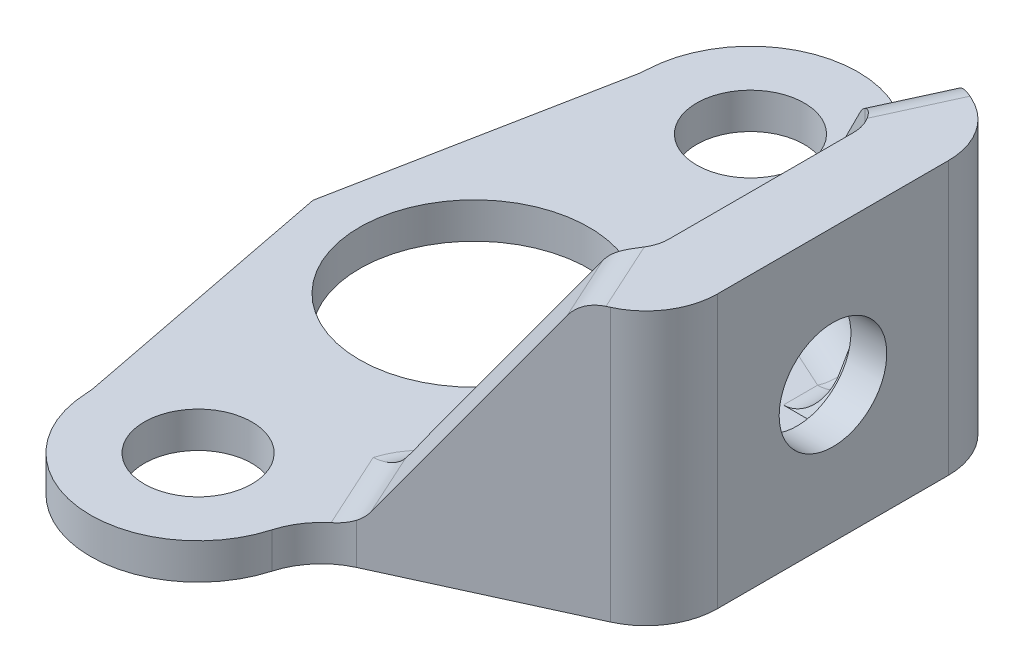
from build123d import *

# Parameters (mm, degrees)
ESQUISSE1_R                  = 3.2
ESQUISSE1_R_2                = 1.5
BOSS_EXTRU_1_DEPTH           = 1
BOSS_EXTRU_2_START           = 6.6
BOSS_EXTRU_2_DEPTH           = 6.6
CHANFREIN1_SIZE              = 6.6
CHANFREIN1_SIZE_2            = 4.73
CONG_1_R                     = 1
ENL_V_MAT_EXTRU_1_DEPTH      = 18.728508153
ENL_V_MAT_EXTRU_1_DEPTH_BACK = 1
ENL_V_MAT_EXTRU_2_DEPTH      = 18.728508153
ENL_V_MAT_EXTRU_2_DEPTH_BACK = 18.728508153
ESQUISSE2_3_R                = 1.5


with BuildPart() as part:
    # Esquisse1 → Boss.-Extru.1 (new body)
    # profile 1 of 2: a face of its own
    with BuildSketch(Plane(origin=(0, 0, 0), x_dir=(1, 0, 0), z_dir=(0, 1, 0))):
        with BuildLine():
            Line((7.41575976, 3.482294806), (4.054342249, 5.018942811))
            ThreePointArc((4.054342249, 5.018942811), (3.533019895, 5.579308264), (3.560627534, 6.344177047))
            Line((3.560627534, 6.344177047), (3.976387294, 7.253651523))
            ThreePointArc((3.976387294, 7.253651523), (3.291254041, 7.768850358), (2.884744089, 8.523560284))
            ThreePointArc((2.884744089, 8.523560284), (-0.351141019, 10.679379127), (-2.997167453, 7.830335178))
            ThreePointArc((-2.997167453, 7.830335178), (-3.009169797, 7.681917242), (-3.032181114, 7.534803614))
            Line((-3.032181114, 7.534803614), (-4.5, 0))
            Line((-4.5, 0), (-3.032181114, -7.534803614))
            ThreePointArc((-3.032181114, -7.534803614), (-3.009169797, -7.681917242), (-2.997167453, -7.830335178))
            ThreePointArc((-2.997167453, -7.830335178), (-0.351141019, -10.679379127), (2.884744089, -8.523560284))
            ThreePointArc((2.884744089, -8.523560284), (3.291254041, -7.768850358), (3.976387294, -7.253651523))
            Line((3.976387294, -7.253651523), (3.560627534, -6.344177047))
            ThreePointArc((3.560627534, -6.344177047), (3.533019895, -5.579308264), (4.054342249, -5.018942811))
            Line((4.054342249, -5.018942811), (7.41575976, -3.482294806))
            ThreePointArc((7.41575976, -3.482294806), (7.841355977, -3.113301708), (8, -2.572820331))
            Line((8, -2.572820331), (8, 2.572820331))
            ThreePointArc((8, 2.572820331), (7.841355977, 3.113301708), (7.41575976, 3.482294806))
        make_face()
        with Locations(Location((0, 0, 0), (0, 0, 270))):
            Circle(ESQUISSE1_R, mode=Mode.SUBTRACT)
        with Locations(Location((0, 7.7, 0), (0, 0, 270))):
            Circle(ESQUISSE1_R_2, mode=Mode.SUBTRACT)
        with Locations(Location((0, -7.7, 0), (0, 0, 270))):
            Circle(ESQUISSE1_R_2, mode=Mode.SUBTRACT)
    # profile 2 of 2: a face of its own
    with BuildSketch(Plane(origin=(0, 0, 0), x_dir=(1, 0, 0), z_dir=(0, 1, 0))):
        with BuildLine():
            ThreePointArc((4.054342249, 5.018942811), (3.533019895, 5.579308264), (3.560627534, 6.344177047))
            Line((3.560627534, 6.344177047), (3.976387294, 7.253651523))
            Line((3.976387294, 7.253651523), (8.831519521, 5.034162505))
            ThreePointArc((8.831519521, 5.034162505), (9.682711954, 4.29617631), (10, 3.215213554))
            Line((10, 3.215213554), (10, -3.215213554))
            ThreePointArc((10, -3.215213554), (9.682711954, -4.29617631), (8.831519521, -5.034162505))
            Line((8.831519521, -5.034162505), (3.976387294, -7.253651523))
            Line((3.976387294, -7.253651523), (3.560627534, -6.344177047))
            ThreePointArc((3.560627534, -6.344177047), (3.533019895, -5.579308264), (4.054342249, -5.018942811))
            Line((4.054342249, -5.018942811), (7.41575976, -3.482294806))
            ThreePointArc((7.41575976, -3.482294806), (7.841355977, -3.113301708), (8, -2.572820331))
            Line((8, -2.572820331), (8, 2.572820331))
            ThreePointArc((8, 2.572820331), (7.841355977, 3.113301708), (7.41575976, 3.482294806))
            Line((7.41575976, 3.482294806), (4.054342249, 5.018942811))
        make_face()
    extrude(amount=-BOSS_EXTRU_1_DEPTH)

    # Esquisse1<3> → Boss.-Extru.2 (add)
    with BuildSketch(Plane(origin=(0, 0, 0), x_dir=(1, 0, 0), z_dir=(0, 1, 0)).offset(BOSS_EXTRU_2_START)):
        with BuildLine():
            ThreePointArc((4.054342249, 5.018942811), (3.533019895, 5.579308264), (3.560627534, 6.344177047))
            Line((3.560627534, 6.344177047), (3.976387294, 7.253651523))
            Line((3.976387294, 7.253651523), (8.831519521, 5.034162505))
            ThreePointArc((8.831519521, 5.034162505), (9.682711954, 4.29617631), (10, 3.215213554))
            Line((10, 3.215213554), (10, -3.215213554))
            ThreePointArc((10, -3.215213554), (9.682711954, -4.29617631), (8.831519521, -5.034162505))
            Line((8.831519521, -5.034162505), (3.976387294, -7.253651523))
            Line((3.976387294, -7.253651523), (3.560627534, -6.344177047))
            ThreePointArc((3.560627534, -6.344177047), (3.533019895, -5.579308264), (4.054342249, -5.018942811))
            Line((4.054342249, -5.018942811), (7.41575976, -3.482294806))
            ThreePointArc((7.41575976, -3.482294806), (7.841355977, -3.113301708), (8, -2.572820331))
            Line((8, -2.572820331), (8, 2.572820331))
            ThreePointArc((8, 2.572820331), (7.841355977, 3.113301708), (7.41575976, 3.482294806))
            Line((7.41575976, 3.482294806), (4.054342249, 5.018942811))
        make_face()
    extrude(amount=-BOSS_EXTRU_2_DEPTH)

    # Chanfrein1
    # the kernel refuses this chamfer: 6.6, 4.73 mm, written as the material it takes off along each edge
    with BuildSketch(Plane(origin=(11.061264904, 6.6, 22.751821295), x_dir=(-0.020518924966706303, -0.9997454615139245, 0.009380079984775464), z_dir=(-0.4157597602676271, 0, -0.9094744755858766))) as chanfrein1_piece_1_section:
        Polygon((CHANFREIN1_SIZE * 0.999745461514, -CHANFREIN1_SIZE * 0.0225612983294), (-CHANFREIN1_SIZE_2 * 0.0225612983294, -CHANFREIN1_SIZE_2 * 0.999745461514), (0, 0), align=None)
    chanfrein1_piece_1 = extrude(amount=35.081593686, mode=Mode.PRIVATE)
    chanfrein1_piece_1 = split(chanfrein1_piece_1, bisect_by=Plane(origin=(5.170241743, 0, 6.158121449), z_dir=(0, 1, 0)), keep=Keep.TOP, mode=Mode.PRIVATE)
    add(chanfrein1_piece_1, mode=Mode.SUBTRACT)
    with BuildSketch(Plane(origin=(-3.524250076, 6.6, 9.153992725), x_dir=(-0.0205189249667065, -0.9997454615139245, -0.009380079984775552), z_dir=(0.4157597602676271, 0, -0.9094744755858766))) as chanfrein1_piece_2_section:
        Polygon((CHANFREIN1_SIZE * 0.999745461514, -CHANFREIN1_SIZE * 0.0225612983294), (-CHANFREIN1_SIZE_2 * 0.0225612983294, -CHANFREIN1_SIZE_2 * 0.999745461514), (0, 0), align=None)
    chanfrein1_piece_2 = extrude(amount=35.081593686, mode=Mode.PRIVATE)
    chanfrein1_piece_2 = split(chanfrein1_piece_2, bisect_by=Plane(origin=(5.170241743, 0, -6.158121449), z_dir=(0, 1, 0)), keep=Keep.TOP, mode=Mode.PRIVATE)
    add(chanfrein1_piece_2, mode=Mode.SUBTRACT)

    # Congé1
    cong_1_edges = [part.edges().sort_by_distance(p)[0] for p in [
        (7.862321613, 6.6, 4.377370464),
        (7.862321613, 6.6, -4.377370464),
        (3.768507414, 0, 6.798914285),
        (5.735051005, 0, 4.250618809),
        (7.841355977, 0, 3.113301708),
        (8, 0, 0),
        (7.841355977, 0, -3.113301708),
        (5.735051005, 0, -4.250618809),
        (3.768507414, 0, -6.798914285),
    ]]
    fillet(cong_1_edges, radius=CONG_1_R)

    # Esquisse2 → Enlèv. mat.-Extru.1 (cut, two sides: drawn at the far end of the back side and taken through both)
    with BuildSketch(Plane.ZY.offset(-8).offset(-ENL_V_MAT_EXTRU_1_DEPTH_BACK)):
        Polygon((3.233161507, 2.8), (1.616580754, 5.6), (-1.616580754, 5.6), (-3.233161507, 2.8), (-1.616580754, 0), (1.616580754, 0), align=None)
    extrude(amount=ENL_V_MAT_EXTRU_1_DEPTH + ENL_V_MAT_EXTRU_1_DEPTH_BACK, mode=Mode.SUBTRACT)

    # Esquisse2<3> → Enlèv. mat.-Extru.2 (cut, two sides: drawn at the far end of the back side and taken through both)
    with BuildSketch(Plane.ZY.offset(-8).offset(-ENL_V_MAT_EXTRU_2_DEPTH_BACK)):
        with Locations((0, 2.8)):
            Circle(ESQUISSE2_3_R)
    extrude(amount=ENL_V_MAT_EXTRU_2_DEPTH + ENL_V_MAT_EXTRU_2_DEPTH_BACK, mode=Mode.SUBTRACT)


solid = part.part
